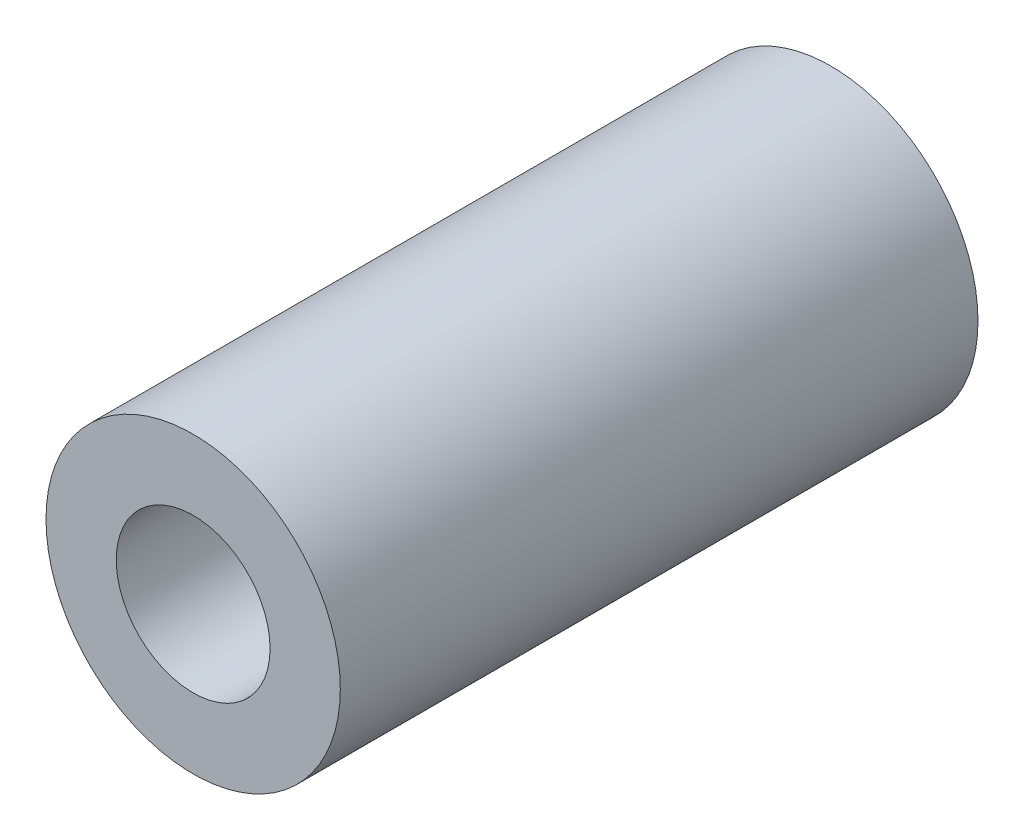
from build123d import *

# Parameters (mm, degrees)
SKETCH1_R           = 4.7625
SKETCH1_R_2         = 2.4892
BOSS_EXTRUDE1_DEPTH = 10.31875


with BuildPart() as part:
    # Sketch1 → Boss-Extrude1 (new, symmetric)
    with BuildSketch(Plane.XY):
        Circle(SKETCH1_R)
        Circle(SKETCH1_R_2, mode=Mode.SUBTRACT)
    extrude(amount=BOSS_EXTRUDE1_DEPTH, both=True)


solid = part.part
